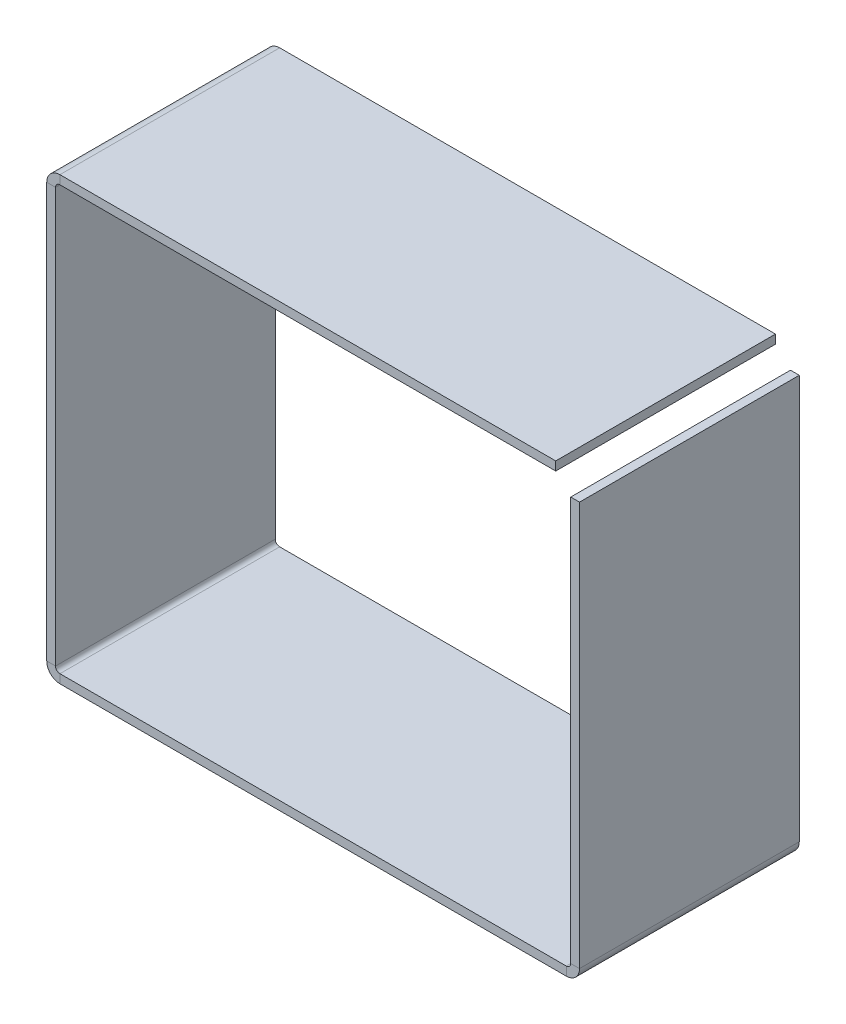
from build123d import *

# Parameters (mm, degrees)
SHEET_EXTRUDE_1_1_DEPTH = 50
THICKEN_1_T1            = 2
SHEET_METAL_1_DEPTH     = 50
SHEET_METAL_1_2_DEPTH   = 50


# Read off the part's stored shape, not the designer's step: Преобразовать-Твердое тело1
with BuildPart() as body_1:
    # Sheet Extrude 1: a surface, the sketch's curves swept straight by 50 mm
    with BuildLine(Plane.XY, mode=Mode.PRIVATE) as sheet_extrude_1_1_path:
        Line((-55.428908385, 46.043182684), (61.804118295, 46.043182684))
        Line((61.804118295, 46.043182684), (61.804118295, -50.293322624))
        Line((61.804118295, -50.293322624), (-55.428908385, -50.293322624))
        Line((-55.428908385, -50.293322624), (-55.428908385, 46.043182684))
    sheet_extrude_1_1 = Shell.extrude(sheet_extrude_1_1_path.wire(), (0 * SHEET_EXTRUDE_1_1_DEPTH, 0 * SHEET_EXTRUDE_1_1_DEPTH, 1 * SHEET_EXTRUDE_1_1_DEPTH))
    add(Solid.thicken(sheet_extrude_1_1, THICKEN_1_T1))

    # Sheet Metal 1 outline → Sheet Metal 1 (cut)
    with BuildSketch(Plane.XY):
        Polygon((61.804118295, 46.043182684), (61.804118295, 42.628969122), (63.804118295, 42.628969122), (63.804118295, 48.043182684), (58.389904733, 48.043182684), (58.389904733, 46.043182684), align=None)
        with BuildLine():
            Line((63.804118295, -52.293322624), (63.804118295, -49.293322624))
            ThreePointArc((63.804118295, -49.293322624), (62.925438639, -51.414642968), (60.804118295, -52.293322624))
            Line((60.804118295, -52.293322624), (63.804118295, -52.293322624))
        make_face()
        with BuildLine():
            Line((-57.428908385, -52.293322624), (-54.428908385, -52.293322624))
            ThreePointArc((-54.428908385, -52.293322624), (-56.550228729, -51.414642968), (-57.428908385, -49.293322624))
            Line((-57.428908385, -49.293322624), (-57.428908385, -52.293322624))
        make_face()
        with BuildLine():
            ThreePointArc((-57.428908385, 45.043182684), (-56.550228729, 47.164503028), (-54.428908385, 48.043182684))
            Line((-54.428908385, 48.043182684), (-57.428908385, 48.043182684))
            Line((-57.428908385, 48.043182684), (-57.428908385, 45.043182684))
        make_face()
    extrude(amount=SHEET_METAL_1_DEPTH, mode=Mode.SUBTRACT)

    # Sheet Metal 1 2 outline → Sheet Metal 1 2 (add)
    with BuildSketch(Plane.XY):
        with BuildLine():
            Line((61.804118295, -50.293322624), (61.804118295, -49.293322624))
            ThreePointArc((61.804118295, -49.293322624), (61.511225076, -50.000429405), (60.804118295, -50.293322624))
            Line((60.804118295, -50.293322624), (61.804118295, -50.293322624))
        make_face()
        with BuildLine():
            Line((-55.428908385, -50.293322624), (-54.428908385, -50.293322624))
            ThreePointArc((-54.428908385, -50.293322624), (-55.136015166, -50.000429405), (-55.428908385, -49.293322624))
            Line((-55.428908385, -49.293322624), (-55.428908385, -50.293322624))
        make_face()
        with BuildLine():
            ThreePointArc((-55.428908385, 45.043182684), (-55.136015166, 45.750289465), (-54.428908385, 46.043182684))
            Line((-54.428908385, 46.043182684), (-55.428908385, 46.043182684))
            Line((-55.428908385, 46.043182684), (-55.428908385, 45.043182684))
        make_face()
    extrude(amount=SHEET_METAL_1_2_DEPTH)


solid = body_1.part
